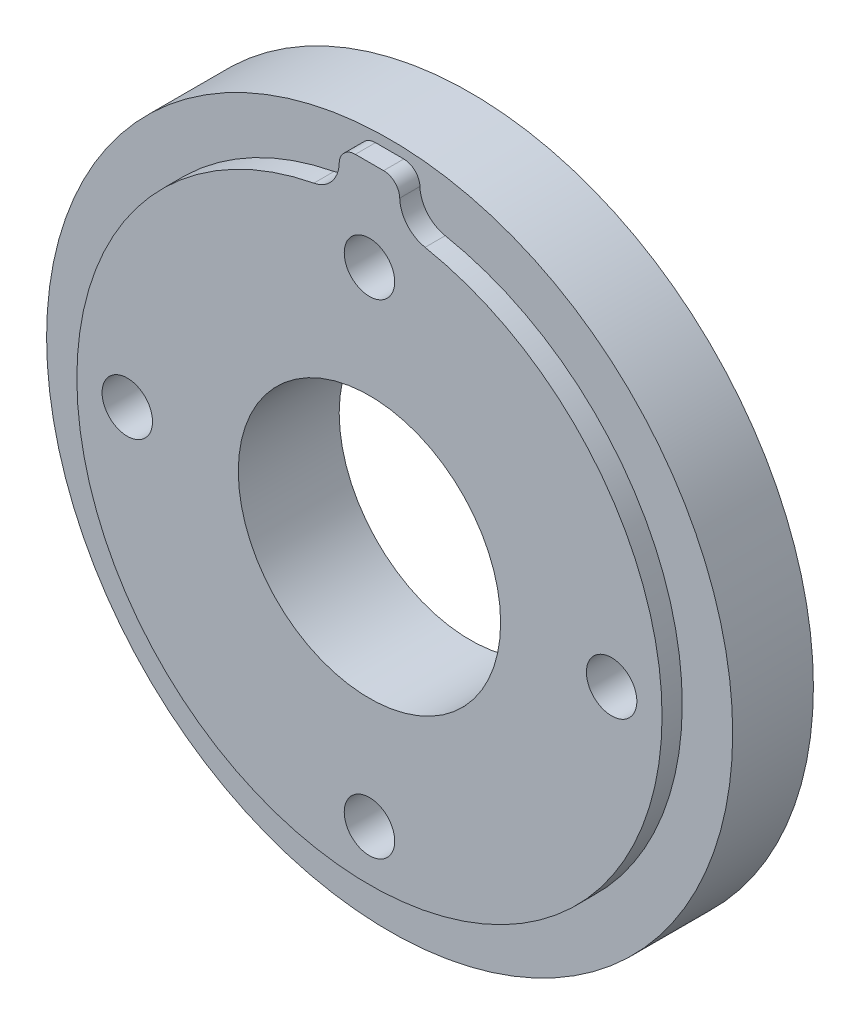
from build123d import *

# Parameters (mm, degrees)
SKETCH_1_R          = 17
EXTRUDE_1_DEPTH     = 4
EXTRUDE_2_DEPTH     = 1
FILLET_1_R          = 1.55
FILLET_2_R          = 0.8
SKETCH_3_R          = 6.5
CUT_EXTRUDE_1_DEPTH = 25.556058454
SKETCH_4_R          = 1.25
CUT_EXTRUDE_2_DEPTH = 25.556058474


with BuildPart() as part:
    # ｽｹｯﾁ1 → ﾎﾞｽ - 押し出し1 (new body)
    with BuildSketch(Plane.XY):
        Circle(SKETCH_1_R)
    extrude(amount=EXTRUDE_1_DEPTH)

    # ｽｹｯﾁ2 → ﾎﾞｽ - 押し出し2 (add)
    with BuildSketch(Plane.XY.offset(4)):
        with BuildLine():
            Line((1.5, 14.422205102), (1.5, 16.5))
            Line((1.5, 16.5), (-1.5, 16.5))
            Line((-1.5, 16.5), (-1.5, 14.422205102))
            ThreePointArc((-1.5, 14.422205102), (0, -14.5), (1.5, 14.422205102))
        make_face()
    extrude(amount=EXTRUDE_2_DEPTH)

    # ﾌｨﾚｯﾄ1
    fillet_1_edges = [part.edges().sort_by_distance(p)[0] for p in [
        (-1.5, 14.422205102, 4.5),
        (1.5, 14.422205102, 4.5),
    ]]
    fillet(fillet_1_edges, radius=FILLET_1_R)

    # ﾌｨﾚｯﾄ2
    fillet_2_edges = [part.edges().sort_by_distance(p)[0] for p in [
        (1.5, 16.5, 4.5),
        (-1.5, 16.5, 4.5),
    ]]
    fillet(fillet_2_edges, radius=FILLET_2_R)

    # ｽｹｯﾁ3 → ｶｯﾄ - 押し出し1 (cut, through all)
    with BuildSketch(Plane.XY.offset(5)):
        Circle(SKETCH_3_R)
    extrude(amount=-CUT_EXTRUDE_1_DEPTH, mode=Mode.SUBTRACT)

    # ｽｹｯﾁ4 → ｶｯﾄ - 押し出し2 (cut, through all)
    with BuildSketch(Plane(origin=(0, 0, 0), x_dir=(-1, 0, 0), z_dir=(0, 0, -1))):
        with Locations((0, 12)):
            Circle(SKETCH_4_R)
        with Locations((12, 0)):
            Circle(SKETCH_4_R)
        with Locations((0, -12)):
            Circle(SKETCH_4_R)
        with Locations((-12, 0)):
            Circle(SKETCH_4_R)
    extrude(amount=-CUT_EXTRUDE_2_DEPTH, mode=Mode.SUBTRACT)


solid = part.part
